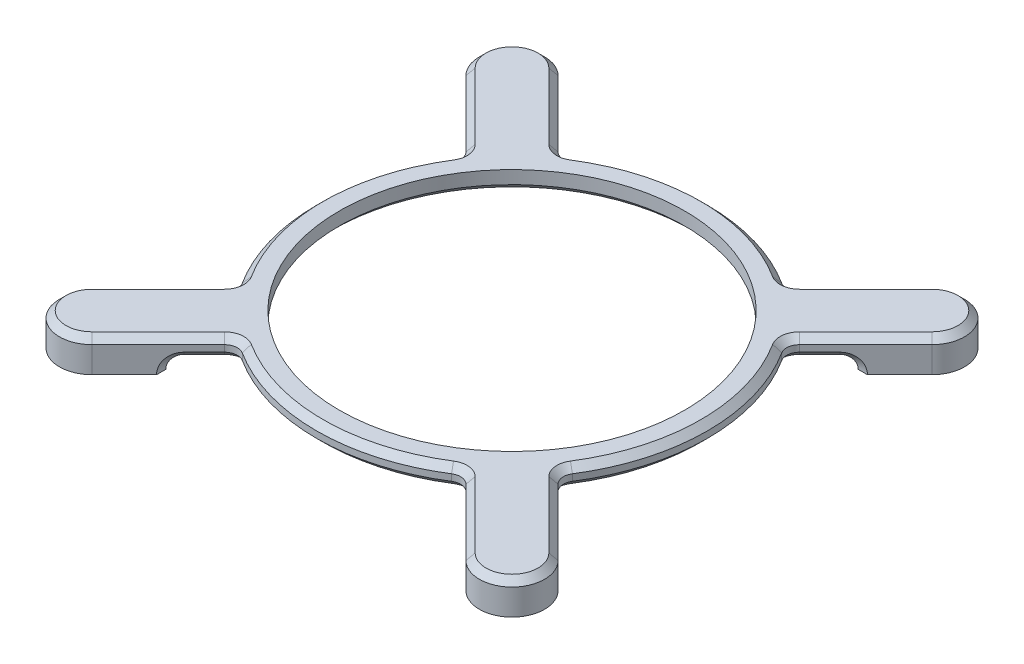
from build123d import *

# Parameters (mm, degrees)
BASE_R              = 3.05
BOSS_EXTRUDE1_DEPTH = 2
BOSS_EXTRUDE2_START = 2
BASE_3_R            = 30
BASE_3_R_2          = 26.5
BASE_3_R_3          = 3.05
BOSS_EXTRUDE2_DEPTH = 3
FILLET1_R           = 2
CHAMFER1_SIZE       = 1
BASE_4_R            = 3.05
CUT_EXTRUDE1_DEPTH  = 3.5


with BuildPart() as part:
    # Base → Boss-Extrude1 (new body)
    # profile 1 of 8: a face of its own
    with BuildSketch(Plane(origin=(0, 0, 0), x_dir=(1, 0, 0), z_dir=(0, 1, 0))):
        with BuildLine():
            Line((-23.037821007, -30.108888819), (-30.108888819, -23.037821007))
            Line((-30.108888819, -23.037821007), (-35.765743068, -28.694675256))
            ThreePointArc((-35.765743068, -28.694675256), (-35.765743068, -35.765743068), (-28.694675256, -35.765743068))
            Line((-28.694675256, -35.765743068), (-23.037821007, -30.108888819))
        make_face()
        with Locations((-32.230209162, -32.230209162)):
            Circle(BASE_R, mode=Mode.SUBTRACT)
    # profile 2 of 8: a face of its own
    with BuildSketch(Plane(origin=(0, 0, 0), x_dir=(1, 0, 0), z_dir=(0, 1, 0))):
        with BuildLine():
            Line((35.765743068, -28.694675256), (30.108888819, -23.037821007))
            Line((30.108888819, -23.037821007), (23.037821007, -30.108888819))
            Line((23.037821007, -30.108888819), (28.694675256, -35.765743068))
            ThreePointArc((28.694675256, -35.765743068), (35.765743068, -35.765743068), (35.765743068, -28.694675256))
        make_face()
        with Locations((32.230209162, -32.230209162)):
            Circle(BASE_R, mode=Mode.SUBTRACT)
    # profile 3 of 8: a face of its own
    with BuildSketch(Plane(origin=(0, 0, 0), x_dir=(1, 0, 0), z_dir=(0, 1, 0))):
        with BuildLine():
            Line((28.694675256, 35.765743068), (23.037821007, 30.108888819))
            Line((23.037821007, 30.108888819), (30.108888819, 23.037821007))
            Line((30.108888819, 23.037821007), (35.765743068, 28.694675256))
            ThreePointArc((35.765743068, 28.694675256), (35.765743068, 35.765743068), (28.694675256, 35.765743068))
        make_face()
        with Locations((32.230209162, 32.230209162)):
            Circle(BASE_R, mode=Mode.SUBTRACT)
    # profile 4 of 8: a face of its own
    with BuildSketch(Plane(origin=(0, 0, 0), x_dir=(1, 0, 0), z_dir=(0, 1, 0))):
        with BuildLine():
            Line((-23.037821007, 30.108888819), (-28.694675256, 35.765743068))
            ThreePointArc((-28.694675256, 35.765743068), (-35.765743068, 35.765743068), (-35.765743068, 28.694675256))
            Line((-35.765743068, 28.694675256), (-30.108888819, 23.037821007))
            Line((-30.108888819, 23.037821007), (-23.037821007, 30.108888819))
        make_face()
        with Locations((-32.230209162, 32.230209162)):
            Circle(BASE_R, mode=Mode.SUBTRACT)
    # profile 5 of 8: a face of its own
    with BuildSketch(Plane(origin=(0, 0, 0), x_dir=(1, 0, 0), z_dir=(0, 1, 0))):
        with Locations((32.230209162, 32.230209162)):
            Circle(BASE_R)
    # profile 6 of 8: a face of its own
    with BuildSketch(Plane(origin=(0, 0, 0), x_dir=(1, 0, 0), z_dir=(0, 1, 0))):
        with Locations((-32.230209162, 32.230209162)):
            Circle(BASE_R)
    # profile 7 of 8: a face of its own
    with BuildSketch(Plane(origin=(0, 0, 0), x_dir=(1, 0, 0), z_dir=(0, 1, 0))):
        with Locations((-32.230209162, -32.230209162)):
            Circle(BASE_R)
    # profile 8 of 8: a face of its own
    with BuildSketch(Plane(origin=(0, 0, 0), x_dir=(1, 0, 0), z_dir=(0, 1, 0))):
        with Locations((32.230209162, -32.230209162)):
            Circle(BASE_R)
    extrude(amount=BOSS_EXTRUDE1_DEPTH)

    # Base<3> → Boss-Extrude2 (add)
    # profile 1 of 13: a face of its own
    with BuildSketch(Plane(origin=(0, 0, 0), x_dir=(1, 0, 0), z_dir=(0, 1, 0)).offset(BOSS_EXTRUDE2_START)):
        Circle(BASE_3_R)
        with Locations(Location((0, 0, 0), (0, 0, 270))):
            Circle(BASE_3_R_2, mode=Mode.SUBTRACT)
    # profile 2 of 13: a face of its own
    with BuildSketch(Plane(origin=(0, 0, 0), x_dir=(1, 0, 0), z_dir=(0, 1, 0)).offset(BOSS_EXTRUDE2_START)):
        with BuildLine():
            ThreePointArc((-17.380966757, -24.452034569), (-21.213203436, -21.213203436), (-24.452034569, -17.380966757))
            Line((-24.452034569, -17.380966757), (-30.108888819, -23.037821007))
            Line((-30.108888819, -23.037821007), (-23.037821007, -30.108888819))
            Line((-23.037821007, -30.108888819), (-17.380966757, -24.452034569))
        make_face()
    # profile 3 of 13: a face of its own
    with BuildSketch(Plane(origin=(0, 0, 0), x_dir=(1, 0, 0), z_dir=(0, 1, 0)).offset(BOSS_EXTRUDE2_START)):
        with BuildLine():
            Line((-23.037821007, -30.108888819), (-30.108888819, -23.037821007))
            Line((-30.108888819, -23.037821007), (-35.765743068, -28.694675256))
            ThreePointArc((-35.765743068, -28.694675256), (-35.765743068, -35.765743068), (-28.694675256, -35.765743068))
            Line((-28.694675256, -35.765743068), (-23.037821007, -30.108888819))
        make_face()
        with Locations((-32.230209162, -32.230209162)):
            Circle(BASE_3_R_3, mode=Mode.SUBTRACT)
    # profile 4 of 13: a face of its own
    with BuildSketch(Plane(origin=(0, 0, 0), x_dir=(1, 0, 0), z_dir=(0, 1, 0)).offset(BOSS_EXTRUDE2_START)):
        with BuildLine():
            Line((30.108888819, -23.037821007), (24.452034569, -17.380966757))
            ThreePointArc((24.452034569, -17.380966757), (21.213203436, -21.213203436), (17.380966757, -24.452034569))
            Line((17.380966757, -24.452034569), (23.037821007, -30.108888819))
            Line((23.037821007, -30.108888819), (30.108888819, -23.037821007))
        make_face()
    # profile 5 of 13: a face of its own
    with BuildSketch(Plane(origin=(0, 0, 0), x_dir=(1, 0, 0), z_dir=(0, 1, 0)).offset(BOSS_EXTRUDE2_START)):
        with BuildLine():
            Line((35.765743068, -28.694675256), (30.108888819, -23.037821007))
            Line((30.108888819, -23.037821007), (23.037821007, -30.108888819))
            Line((23.037821007, -30.108888819), (28.694675256, -35.765743068))
            ThreePointArc((28.694675256, -35.765743068), (35.765743068, -35.765743068), (35.765743068, -28.694675256))
        make_face()
        with Locations((32.230209162, -32.230209162)):
            Circle(BASE_3_R_3, mode=Mode.SUBTRACT)
    # profile 6 of 13: a face of its own
    with BuildSketch(Plane(origin=(0, 0, 0), x_dir=(1, 0, 0), z_dir=(0, 1, 0)).offset(BOSS_EXTRUDE2_START)):
        with BuildLine():
            Line((23.037821007, 30.108888819), (17.380966757, 24.452034569))
            ThreePointArc((17.380966757, 24.452034569), (21.213203436, 21.213203436), (24.452034569, 17.380966757))
            Line((24.452034569, 17.380966757), (30.108888819, 23.037821007))
            Line((30.108888819, 23.037821007), (23.037821007, 30.108888819))
        make_face()
    # profile 7 of 13: a face of its own
    with BuildSketch(Plane(origin=(0, 0, 0), x_dir=(1, 0, 0), z_dir=(0, 1, 0)).offset(BOSS_EXTRUDE2_START)):
        with BuildLine():
            Line((28.694675256, 35.765743068), (23.037821007, 30.108888819))
            Line((23.037821007, 30.108888819), (30.108888819, 23.037821007))
            Line((30.108888819, 23.037821007), (35.765743068, 28.694675256))
            ThreePointArc((35.765743068, 28.694675256), (35.765743068, 35.765743068), (28.694675256, 35.765743068))
        make_face()
        with Locations((32.230209162, 32.230209162)):
            Circle(BASE_3_R_3, mode=Mode.SUBTRACT)
    # profile 8 of 13: a face of its own
    with BuildSketch(Plane(origin=(0, 0, 0), x_dir=(1, 0, 0), z_dir=(0, 1, 0)).offset(BOSS_EXTRUDE2_START)):
        with BuildLine():
            Line((-17.380966757, 24.452034569), (-23.037821007, 30.108888819))
            Line((-23.037821007, 30.108888819), (-30.108888819, 23.037821007))
            Line((-30.108888819, 23.037821007), (-24.452034569, 17.380966757))
            ThreePointArc((-24.452034569, 17.380966757), (-21.213203436, 21.213203436), (-17.380966757, 24.452034569))
        make_face()
    # profile 9 of 13: a face of its own
    with BuildSketch(Plane(origin=(0, 0, 0), x_dir=(1, 0, 0), z_dir=(0, 1, 0)).offset(BOSS_EXTRUDE2_START)):
        with BuildLine():
            Line((-23.037821007, 30.108888819), (-28.694675256, 35.765743068))
            ThreePointArc((-28.694675256, 35.765743068), (-35.765743068, 35.765743068), (-35.765743068, 28.694675256))
            Line((-35.765743068, 28.694675256), (-30.108888819, 23.037821007))
            Line((-30.108888819, 23.037821007), (-23.037821007, 30.108888819))
        make_face()
        with Locations((-32.230209162, 32.230209162)):
            Circle(BASE_3_R_3, mode=Mode.SUBTRACT)
    # profile 10 of 13: a face of its own
    with BuildSketch(Plane(origin=(0, 0, 0), x_dir=(1, 0, 0), z_dir=(0, 1, 0)).offset(BOSS_EXTRUDE2_START)):
        with Locations((-32.230209162, 32.230209162)):
            Circle(BASE_3_R_3)
    # profile 11 of 13: a face of its own
    with BuildSketch(Plane(origin=(0, 0, 0), x_dir=(1, 0, 0), z_dir=(0, 1, 0)).offset(BOSS_EXTRUDE2_START)):
        with Locations((-32.230209162, -32.230209162)):
            Circle(BASE_3_R_3)
    # profile 12 of 13: a face of its own
    with BuildSketch(Plane(origin=(0, 0, 0), x_dir=(1, 0, 0), z_dir=(0, 1, 0)).offset(BOSS_EXTRUDE2_START)):
        with Locations((32.230209162, -32.230209162)):
            Circle(BASE_3_R_3)
    # profile 13 of 13: a face of its own
    with BuildSketch(Plane(origin=(0, 0, 0), x_dir=(1, 0, 0), z_dir=(0, 1, 0)).offset(BOSS_EXTRUDE2_START)):
        with Locations((32.230209162, 32.230209162)):
            Circle(BASE_3_R_3)
    extrude(amount=BOSS_EXTRUDE2_DEPTH)

    # Fillet1
    fillet1_edges = [part.edges().sort_by_distance(p)[0] for p in [
        (24.452034569, 3.5, 17.380966757),
        (-17.380966757, 3.5, -24.452034569),
        (24.452034569, 3.5, -17.380966757),
        (-17.380966757, 3.5, 24.452034569),
        (17.380966757, 3.5, -24.452034569),
        (-24.452034569, 3.5, 17.380966757),
        (17.380966757, 3.5, 24.452034569),
        (-24.452034569, 3.5, -17.380966757),
        (-26.573354913, 2, 26.573354913),
        (-26.573354913, 2, -26.573354913),
        (26.573354913, 2, 26.573354913),
        (26.573354913, 2, -26.573354913),
    ]]
    fillet(fillet1_edges, radius=FILLET1_R - 0.0001)  # a hair under: the kernel refuses the full size

    # Chamfer1
    chamfer1_edges = [part.edges().sort_by_distance(p)[0] for p in [
        (23.619243451, 5, 30.690311263),
        (0, 5, 30),
        (-23.619243451, 5, 30.690311263),
        (-30.690311263, 5, 23.619243451),
        (-30, 5, 0),
        (-30.690311263, 5, -23.619243451),
        (-23.619243451, 5, -30.690311263),
        (0, 5, -30),
        (30.690311263, 5, -23.619243451),
        (30, 5, 0),
        (30.690311263, 5, 23.619243451),
        (23.619243451, 5, -30.690311263),
        (-29.694695967, 1.414242852, 22.623628155),
        (-22.623628155, 1.414242852, 29.694695967),
        (-22.623628155, 1.414242852, -29.694695967),
        (-29.694695967, 1.414242852, -22.623628155),
        (22.623628155, 1.414242852, 29.694695967),
        (29.694695967, 1.414242852, 22.623628155),
        (29.694695967, 1.414242852, -22.623628155),
        (22.623628155, 1.414242852, -29.694695967),
        (17.349741935, 2, 25.041267842),
        (17.349741935, 5, 25.041267842),
        (-17.349741935, 2, 25.041267842),
        (-17.349741935, 5, 25.041267842),
        (-25.041267842, 2, 17.349741935),
        (-25.041267842, 5, 17.349741935),
        (-25.041267842, 2, -17.349741935),
        (-25.041267842, 5, -17.349741935),
        (-17.349741935, 2, -25.041267842),
        (-17.349741935, 5, -25.041267842),
        (25.041267842, 2, -17.349741935),
        (25.041267842, 5, -17.349741935),
        (25.041267842, 2, 17.349741935),
        (25.041267842, 5, 17.349741935),
        (17.349741935, 2, -25.041267842),
        (17.349741935, 5, -25.041267842),
        (0, 2, -26.5),
        (35.765743068, 5, 35.765743068),
        (35.765743068, 5, -35.765743068),
        (-35.765743068, 5, -35.765743068),
        (-35.765743068, 5, 35.765743068),
        (-20.083744901, 2, -27.154812712),
        (0, 2, -30),
        (20.083744901, 2, -27.154812712),
        (27.154812712, 2, -20.083744901),
        (30, 2, 0),
        (27.154812712, 2, 20.083744901),
        (20.083744901, 2, 27.154812712),
        (0, 2, 30),
        (-20.083744901, 2, 27.154812712),
        (-27.154812712, 2, 20.083744901),
        (-30, 2, 0),
        (-27.154812712, 2, -20.083744901),
    ]]
    chamfer(chamfer1_edges, length=CHAMFER1_SIZE)

    # Base<4> → Cut-Extrude1 (cut)
    with BuildSketch(Plane(origin=(0, 0, 0), x_dir=(1, 0, 0), z_dir=(0, 1, 0))):
        with Locations(Location((32.230209162, -32.230209162, 0), (0, 0, 270))):
            Circle(BASE_4_R)
        with Locations(Location((-32.230209162, -32.230209162, 0), (0, 0, 270))):
            Circle(BASE_4_R)
        with Locations(Location((-32.230209162, 32.230209162, 0), (0, 0, 270))):
            Circle(BASE_4_R)
        with Locations(Location((32.230209162, 32.230209162, 0), (0, 0, 270))):
            Circle(BASE_4_R)
    extrude(amount=CUT_EXTRUDE1_DEPTH, mode=Mode.SUBTRACT)


solid = part.part
